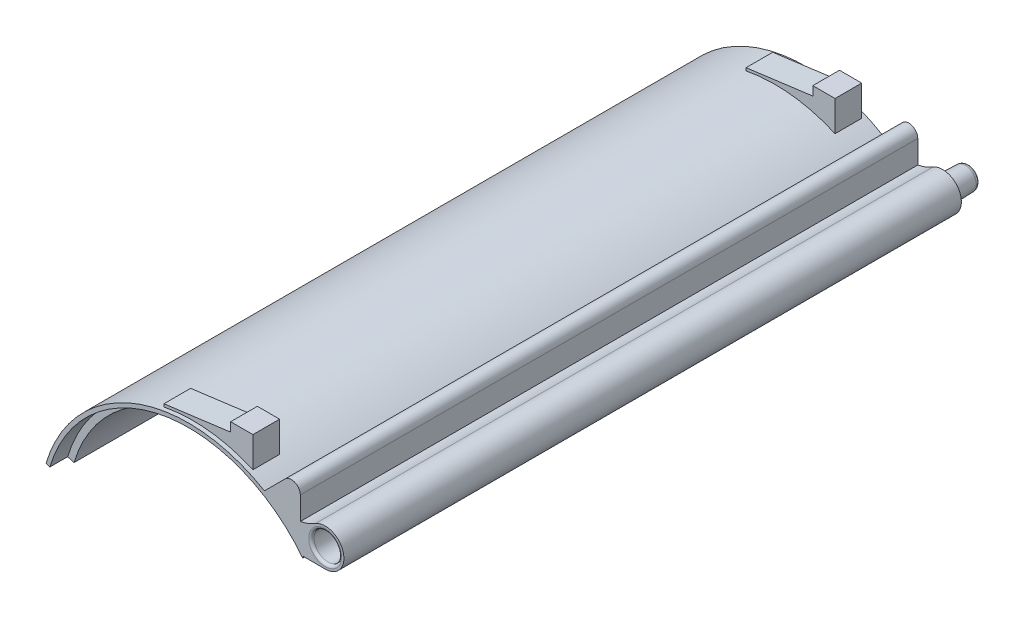
from build123d import *

# Parameters (mm, degrees)
BOSS_EXTRU_1_DEPTH      = 1.8
BOSS_EXTRU_2_DEPTH      = 67.6
ESQUISSE3_R             = 1.35
BOSS_EXTRU_3_DEPTH      = 3
BOSS_EXTRU_3_DRAFT      = -2
BOSS_EXTRU_4_DEPTH      = 69.4
CONG_1_R                = 5
ESQUISSE5_R             = 1.55
ENL_V_MAT_EXTRU_1_DEPTH = 20
BOSS_EXTRU_5_START      = 0.486262707
BOSS_EXTRU_5_DEPTH      = 3
ENL_V_START             = -2
ENL_V_MAT_EXTRU_2_DEPTH = 2
ENL_V_MAT_EXTRU_3_DEPTH = 83.186412318
BOSS_EXTRU_6_DEPTH      = 69.4
CONG_2_R                = 1
CONG_3_R                = 0.3
CONG_4_R                = 0.5


# Read off the part's stored shape, not the designer's step: Boss.-Extru.5
with BuildPart() as part:
    # Esquisse1 → Boss.-Extru.1 (new body)
    with BuildSketch(Plane.XY):
        with BuildLine():
            Line((-33.169498422, 7.22242532), (-33.600967303, 7.350232225))
            ThreePointArc((-33.600967303, 7.350232225), (-21.461995756, 18.851787613), (-5.439284285, 14.065022141))
            Line((-5.439284285, 14.065022141), (-5.439284285, 13.398595658))
            ThreePointArc((-5.439284285, 13.398595658), (-21.121374045, 18.468530159), (-33.169498422, 7.22242532))
        make_face()
    extrude(amount=BOSS_EXTRU_1_DEPTH)

    # Esquisse2 → Boss.-Extru.2 (add)
    with BuildSketch(Plane.XY.offset(1.8)):
        with BuildLine():
            Line((-33.600967303, 7.350232225), (-32.450383621, 7.009413812))
            ThreePointArc((-32.450383621, 7.009413812), (-19.947199013, 17.926685666), (-4.739284285, 11.275687265))
            Line((-4.739284285, 11.275687265), (-4.739284285, 13.274091553))
            ThreePointArc((-4.739284285, 13.274091553), (-5.083029835, 13.675092245), (-5.439284285, 14.065022141))
            ThreePointArc((-5.439284285, 14.065022141), (-21.461995756, 18.851787613), (-33.600967303, 7.350232225))
        make_face()
    extrude(amount=BOSS_EXTRU_2_DEPTH)



with BuildPart() as body_2:
    # Esquisse3 → Boss.-Extru.3 (with draft: the straight prism first)
    with BuildSketch(Plane.XY):
        with Locations((-2.219642143, 14.857175969)):
            Circle(ESQUISSE3_R)
    extrude(amount=-BOSS_EXTRU_3_DEPTH)
    # Boss.-Extru.3: the draft: its side faces are tilted about the plane it starts from
    boss_extru_3_sides = [body_2.faces().sort_by_distance(p)[0] for p in [
        (-3.569642143, 14.857175969, -1.5),
    ]]
    draft(boss_extru_3_sides, Plane.XY, BOSS_EXTRU_3_DRAFT)


with BuildPart() as part_1:
    add(part.part)

    add(body_2.part)  # Boss.-Extru.4 merges body 2
    # Esquisse4 → Boss.-Extru.4 (add)
    with BuildSketch(Plane.XY):
        with BuildLine():
            Line((-2.233779809, 12.757223558), (-4.739284285, 12.774091553))
            Line((-4.739284285, 12.774091553), (-6.149439768, 14.774091553))
            Line((-6.149439768, 14.774091553), (-3.378858565, 16.608237729))
            ThreePointArc((-3.378858565, 16.608237729), (-0.206741875, 15.455701249), (-2.233779809, 12.757223558))
        make_face()
    extrude(amount=BOSS_EXTRU_4_DEPTH)

    # Congé1
    cong_1_edges = [part_1.edges().sort_by_distance(p)[0] for p in [
        (-6.149439768, 14.774091553, 34.7),
    ]]
    fillet(cong_1_edges, radius=CONG_1_R)

    # Esquisse5 → Enlèv. mat.-Extru.1 (cut)
    with BuildSketch(Plane.XY.offset(69.4)):
        with Locations((-2.219642143, 14.857175969)):
            Circle(ESQUISSE5_R)
    extrude(amount=-ENL_V_MAT_EXTRU_1_DEPTH, mode=Mode.SUBTRACT)

    # Boss.-Extru.5 outline → Boss.-Extru.5 (add)
    with BuildSketch(Plane.XY.offset(BOSS_EXTRU_5_START)):
        with BuildLine():
            Line((-10.832608102, 17.879553752), (-10.832608102, 21.307175969))
            Line((-10.832608102, 21.307175969), (-20.832608102, 21.307175969))
            Line((-20.832608102, 21.307175969), (-20.832608102, 18.989084153))
            ThreePointArc((-20.832608102, 18.989084153), (-15.747062959, 19.205322101), (-10.832608102, 17.879553752))
        make_face()
    boss_extru_5 = extrude(amount=BOSS_EXTRU_5_DEPTH)

    # Symétrie1: Boss.-Extru.5 across plane
    add(boss_extru_5.mirror(Plane.XY.offset(34.7)))

    # Esquisse7 → Enlèv. mat.-Extru.2 (cut)
    with BuildSketch(Plane.XY.offset(69.4).offset(ENL_V_START)):
        with BuildLine():
            Line((-32.450383621, 7.009413812), (-33.169498422, 7.22242532))
            ThreePointArc((-33.169498422, 7.22242532), (-20.584304116, 18.578673161), (-4.739284285, 12.554818307))
            Line((-4.739284285, 12.554818307), (-4.739284285, 11.275687265))
            ThreePointArc((-4.739284285, 11.275687265), (-19.947199013, 17.926685666), (-32.450383621, 7.009413812))
        make_face()
    extrude(amount=ENL_V_MAT_EXTRU_2_DEPTH, mode=Mode.SUBTRACT)

    # Esquisse9 → Enlèv. mat.-Extru.3 (cut, through all)
    with BuildSketch(Plane.XY.offset(68.913737293)):
        Polygon((-20.832608102, 19.307175969), (-13.332608102, 20.294569701), (-13.332608102, 21.307175969), (-20.832608102, 21.307175969), align=None)
    extrude(amount=-ENL_V_MAT_EXTRU_3_DEPTH, mode=Mode.SUBTRACT)

    # Esquisse10 → Boss.-Extru.6 (add)
    with BuildSketch(Plane.XY.offset(69.4)):
        Polygon((-5.019642143, 15.993667324), (-5.019642143, 20.993667324), (-9.052568259, 16.960741208), (-4.646335714, 14.274994024), align=None)
    extrude(amount=-BOSS_EXTRU_6_DEPTH)

    # Congé2
    cong_2_edges = [part_1.edges().sort_by_distance(p)[0] for p in [
        (-5.019642143, 20.993667324, 34.7),
    ]]
    fillet(cong_2_edges, radius=CONG_2_R)

    # Congé3
    cong_3_edges = [part_1.edges().sort_by_distance(p)[0] for p in [
        (-3.769642143, 14.857175969, 69.4),
    ]]
    fillet(cong_3_edges, radius=CONG_3_R)

    # Congé4
    cong_4_edges = [part_1.edges().sort_by_distance(p)[0] for p in [
        (-3.464879834, 14.857175969, -3),
    ]]
    fillet(cong_4_edges, radius=CONG_4_R)


solid = part_1.part
